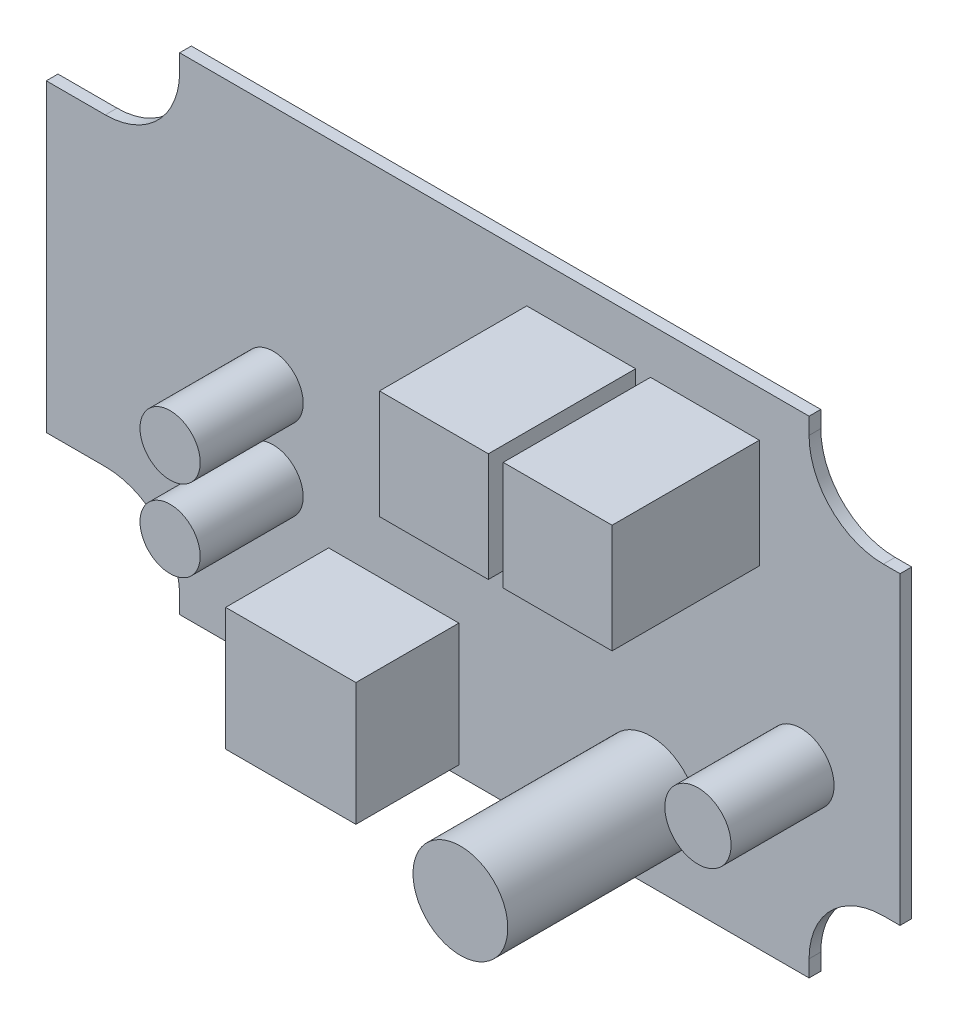
from build123d import *

# Parameters (mm, degrees)
BOSS_EXTRUDE1_DEPTH = 1.5748
SKETCH2_W           = 14.65
SKETCH2_H           = 14.65
BOSS_EXTRUDE2_DEPTH = 19.82
SKETCH3_R           = 6.38
BOSS_EXTRUDE3_DEPTH = 25.62
SKETCH4_R           = 4.05
SKETCH4_R_2         = 4.45846
SKETCH4_W           = 17.528842204
SKETCH4_H           = 16.527194078
BOSS_EXTRUDE4_DEPTH = 13.86


with BuildPart() as part:
    # Sketch1 → Boss-Extrude1 (new body)
    with BuildSketch(Plane.XY):
        with BuildLine():
            Line((42.354093023, -30.703264053), (42.354093023, -32.943264053))
            Line((42.354093023, -32.943264053), (-42.354093023, -32.943264053))
            Line((-42.354093023, -32.943264053), (-42.354093023, -30.703264053))
            ThreePointArc((-42.354093023, -30.703264053), (-45.283025211, -23.632196241), (-52.354093023, -20.703264053))
            Line((-52.354093023, -20.703264053), (-60.301272865, -20.703264053))
            Line((-60.301272865, -20.703264053), (-60.301272865, 20.296735947))
            Line((-60.301272865, 20.296735947), (-52.354093023, 20.296735947))
            ThreePointArc((-52.354093023, 20.296735947), (-45.283025211, 23.225668135), (-42.354093023, 30.296735947))
            Line((-42.354093023, 30.296735947), (-42.354093023, 32.536735947))
            Line((-42.354093023, 32.536735947), (42.354093023, 32.536735947))
            Line((42.354093023, 32.536735947), (42.354093023, 30.296735947))
            ThreePointArc((42.354093023, 30.296735947), (45.283025211, 23.225668135), (52.354093023, 20.296735947))
            Line((52.354093023, 20.296735947), (54.593335979, 20.296735947))
            Line((54.593335979, 20.296735947), (54.593335979, -20.703264053))
            Line((54.593335979, -20.703264053), (52.354093023, -20.703264053))
            ThreePointArc((52.354093023, -20.703264053), (45.283025211, -23.632196241), (42.354093023, -30.703264053))
        make_face()
    extrude(amount=BOSS_EXTRUDE1_DEPTH)

    # Sketch2 → Boss-Extrude2 (add)
    with BuildSketch(Plane.XY.offset(1.5748)):
        with Locations((11.686894588, 19.066351865)):
            Rectangle(SKETCH2_W, SKETCH2_H)
        with Locations((28.336894588, 19.066351865)):
            Rectangle(SKETCH2_W, SKETCH2_H)
    extrude(amount=BOSS_EXTRUDE2_DEPTH)

    # Sketch3 → Boss-Extrude3 (add)
    with BuildSketch(Plane.XY.offset(1.5748)):
        with Locations((21.050882576, -21.779136192)):
            Circle(SKETCH3_R)
    extrude(amount=BOSS_EXTRUDE3_DEPTH)

    # Sketch4 → Boss-Extrude4 (add)
    with BuildSketch(Plane.XY.offset(1.5748)):
        with Locations((-29.775377187, 0)):
            Circle(SKETCH4_R)
        with Locations((-29.775377187, -10.91000664)):
            Circle(SKETCH4_R)
        with Locations((41.26131402, -8.841126254)):
            Circle(SKETCH4_R_2)
        with Locations((-13.538274313, -23.407391016)):
            Rectangle(SKETCH4_W, SKETCH4_H)
    extrude(amount=BOSS_EXTRUDE4_DEPTH)


solid = part.part
